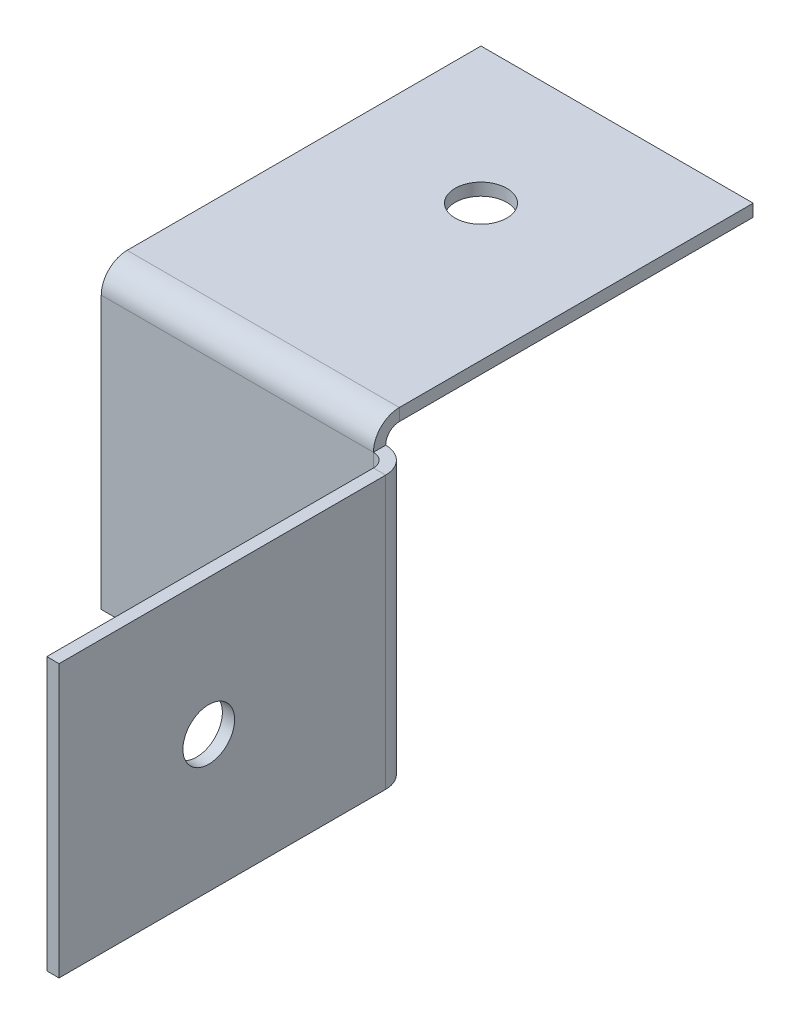
from build123d import *

# Parameters (mm, degrees)
SKETCH1_W                    = 20
SKETCH1_H                    = 20
BASE_FLANGE1_DEPTH           = 0.9
EDGE_FLANGE2_DEPTH           = 20
F_25_0_1495_DIAMETER_SLOT2_D = 3.7973
EDGE_FLANGE4_DEPTH           = 20
F_25_0_1495_DIAMETER_SLOT5_D = 3.7973


# Sheet-metal steps are written as plain solids
with BuildPart() as part:
    # Sketch1 → Base-Flange1 (new body)
    with BuildSketch(Plane.XY):
        Rectangle(SKETCH1_W, SKETCH1_H)
    extrude(amount=-BASE_FLANGE1_DEPTH)

    # Edge-Flange2 section (across the edge) → Edge-Flange2 (add)
    with BuildSketch(Plane(origin=(-10, 11, -0.9), x_dir=(0, -1, 0), z_dir=(1, 0, 0))):
        with BuildLine():
            Line((-0.9, 1), (-0.9, 27))
            Line((-0.9, 27), (0, 27))
            Line((0, 27), (0, 1))
            ThreePointArc((0, 1), (0.292893219, 0.292893219), (1, 0))
            Line((1, 0), (1, -0.9))
            ThreePointArc((1, -0.9), (-0.343502884, -0.343502884), (-0.9, 1))
        make_face()
    extrude(amount=EDGE_FLANGE2_DEPTH)

    # #25 (0.1495) Diameter Slot2 (through all)
    with Locations(Plane(origin=(0, 11.9, 0), x_dir=(1, 0, 0), z_dir=(0, 1, 0))):
        with Locations((0, 17.9)):
            Hole(F_25_0_1495_DIAMETER_SLOT2_D / 2)

    # Edge-Flange4 section (across the edge) → Edge-Flange4 (add)
    with BuildSketch(Plane(origin=(11, -10, 0), x_dir=(-1, 0, 0), z_dir=(0, 1, 0))):
        with BuildLine():
            Line((-0.9, 1), (-0.9, 25))
            Line((-0.9, 25), (0, 25))
            Line((0, 25), (0, 1))
            ThreePointArc((0, 1), (0.292893219, 0.292893219), (1, 0))
            Line((1, 0), (1, -0.9))
            ThreePointArc((1, -0.9), (-0.343502884, -0.343502884), (-0.9, 1))
        make_face()
    extrude(amount=EDGE_FLANGE4_DEPTH)

    # #25 (0.1495) Diameter Slot5 (through all)
    with Locations(Plane.ZY.offset(-11)):
        with Locations((14, 0)):
            Hole(F_25_0_1495_DIAMETER_SLOT5_D / 2)


solid = part.part
